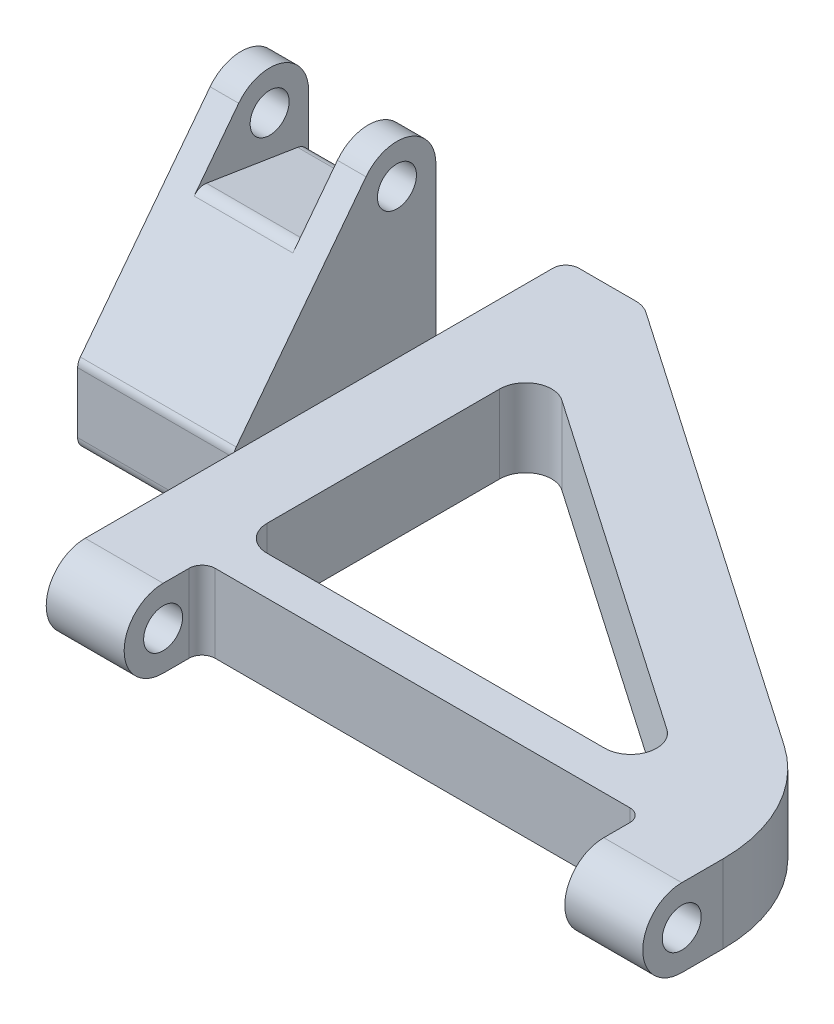
from build123d import *
from build123d.topology import SkipClean

# Parameters (mm, degrees)
BOSS_EXTRUDE1_DEPTH = 19.05
SKETCH7_R           = 4.7625
CUT_EXTRUDE7_DEPTH  = 38.1
FILLET4_R           = 38.1
FILLET5_R           = 6.35
SKETCH8_R           = 4.7625
CUT_EXTRUDE8_DEPTH  = 195.283940649
FILLET6_RADIUS      = 9.525
FILLET6_LENGTH      = 19.05
FILLET7_RADIUS      = 9.525
FILLET7_LENGTH      = 19.05
CUT_EXTRUDE9_START  = -19.05
CUT_EXTRUDE9_DEPTH  = 12.7
CUT_EXTRUDE10_START = -19.05
CUT_EXTRUDE10_DEPTH = 12.7
CUT_EXTRUDE11_START = -19.05
CUT_EXTRUDE11_DEPTH = 12.7
SKETCH12_R          = 4.7625
BOSS_EXTRUDE2_DEPTH = 38.1
CUT_EXTRUDE12_DEPTH = 34.925
CUT_EXTRUDE13_START = -6.985
SKETCH13_4_R        = 4.7625
CUT_EXTRUDE13_DEPTH = 24.13
FILLET13_R          = 3.175
FILLET14_R          = 3.175
FILLET15_R          = 3.175


with BuildPart() as part:
    # Sketch1 → Boss-Extrude1 (new body)
    with BuildSketch(Plane(origin=(0, 0, 0), x_dir=(1, 0, 0), z_dir=(0, 1, 0))):
        with BuildLine():
            ThreePointArc((3.175, 0), (0.92993597, -0.92993597), (0, -3.175))
            Line((0, -3.175), (0, -127))
            Line((0, -127), (19.05, -127))
            Line((19.05, -127), (19.05, -111.125))
            ThreePointArc((19.05, -111.125), (19.97993597, -108.87993597), (22.225, -107.95))
            Line((22.225, -107.95), (123.563707018, -107.95))
            ThreePointArc((123.563707018, -107.95), (125.808771048, -108.87993597), (126.738707018, -111.125))
            Line((126.738707018, -111.125), (126.738707018, -127))
            Line((126.738707018, -127), (145.788707018, -127))
            Line((145.788707018, -127), (145.788707018, -87.316702208))
            Line((145.788707018, -87.316702208), (19.05, 0))
            Line((19.05, 0), (3.175, 0))
        make_face()
        with BuildLine():
            Line((29.002606919, -29.990275978), (111.5275446, -86.845877379))
            ThreePointArc((111.5275446, -86.845877379), (113.98824654, -93.961474404), (107.924937681, -98.425))
            Line((107.924937681, -98.425), (25.4, -98.425))
            ThreePointArc((25.4, -98.425), (20.909871939, -96.565128061), (19.05, -92.075))
            Line((19.05, -92.075), (19.05, -35.2193986))
            ThreePointArc((19.05, -35.2193986), (22.446532033, -29.598052945), (29.002606919, -29.990275978))
        make_face(mode=Mode.SUBTRACT)
    extrude(amount=BOSS_EXTRUDE1_DEPTH)

    # Sketch7 → Cut-Extrude7 (cut)
    with BuildSketch(Plane(origin=(0, 0, 0), x_dir=(-1, 0, 0), z_dir=(0, 0, -1))):
        with Locations((-9.525, 9.525)):
            Circle(SKETCH7_R)
    extrude(amount=-CUT_EXTRUDE7_DEPTH, mode=Mode.SUBTRACT)

    # Fillet4
    fillet4_edges = [part.edges().sort_by_distance(p)[0] for p in [
        (145.788707018, 9.525, 87.316702208),
    ]]
    fillet(fillet4_edges, radius=FILLET4_R)

    # Fillet5
    fillet5_edges = [part.edges().sort_by_distance(p)[0] for p in [
        (19.05, 9.525, 0),
    ]]
    fillet(fillet5_edges, radius=FILLET5_R)

    # Sketch8 → Cut-Extrude8 (cut, through all)
    with BuildSketch(Plane.ZY):
        with Locations((117.475, 9.525)):
            Circle(SKETCH8_R)
    extrude(amount=-CUT_EXTRUDE8_DEPTH, mode=Mode.SUBTRACT)

    # Fillet6: full round fillet: the end face becomes a half cylinder, R = half its width
    fillet6_face = Plane((9.525, 9.525, 127), x_dir=(1, 0, 0), z_dir=(0, 0, 1))  # on the end face: x along it, z out of the body
    fillet6_slab = fillet6_face.offset(-FILLET6_RADIUS / 2) * Box(FILLET6_LENGTH, 2 * FILLET6_RADIUS, FILLET6_RADIUS, mode=Mode.PRIVATE)  # the body's end, R deep
    fillet6_round = Plane((9.525, 9.525, 117.475), x_dir=(0, 0, 1), z_dir=(1, 0, 0)) * Cylinder(FILLET6_RADIUS, FILLET6_LENGTH, mode=Mode.PRIVATE)  # its axis R under the face
    add(fillet6_slab - fillet6_round, mode=Mode.SUBTRACT)

    # Fillet7: full round fillet: the end face becomes a half cylinder, R = half its width
    fillet7_face = Plane((136.263707018, 9.525, 127), x_dir=(-1, 0, 0), z_dir=(0, 0, 1))  # on the end face: x along it, z out of the body
    fillet7_slab = fillet7_face.offset(-FILLET7_RADIUS / 2) * Box(FILLET7_LENGTH, 2 * FILLET7_RADIUS, FILLET7_RADIUS, mode=Mode.PRIVATE)  # the body's end, R deep
    fillet7_round = Plane((136.263707018, 9.525, 117.475), x_dir=(0, 0, 1), z_dir=(-1, 0, 0)) * Cylinder(FILLET7_RADIUS, FILLET7_LENGTH, mode=Mode.PRIVATE)  # its axis R under the face
    add(fillet7_slab - fillet7_round, mode=Mode.SUBTRACT)

    # Sketch9 → Cut-Extrude9 (cut)
    with BuildSketch(Plane(origin=(0, 19.05, 0), x_dir=(1, 0, 0), z_dir=(0, 1, 0)).offset(CUT_EXTRUDE9_START)):
        with BuildLine():
            Line((6.985, -44.45), (12.065, -44.45))
            ThreePointArc((12.065, -44.45), (14.31006403, -45.37993597), (15.24, -47.625))
            Line((15.24, -47.625), (15.24, -92.075))
            Line((15.24, -92.075), (15.24, -102.87))
            ThreePointArc((15.24, -102.87), (14.31006403, -105.11506403), (12.065, -106.045))
            Line((12.065, -106.045), (6.985, -106.045))
            ThreePointArc((6.985, -106.045), (4.73993597, -105.11506403), (3.81, -102.87))
            Line((3.81, -102.87), (3.81, -47.625))
            ThreePointArc((3.81, -47.625), (4.73993597, -45.37993597), (6.985, -44.45))
        make_face()
    extrude(amount=CUT_EXTRUDE9_DEPTH, mode=Mode.SUBTRACT)

    # Sketch10 → Cut-Extrude10 (cut)
    with BuildSketch(Plane(origin=(0, 19.05, 0), x_dir=(1, 0, 0), z_dir=(0, 1, 0)).offset(CUT_EXTRUDE10_START)):
        with BuildLine():
            Line((20.6375, -11.763381719), (20.6375, -17.932294237))
            ThreePointArc((20.6375, -17.932294237), (21.001827173, -19.409028221), (22.011196541, -20.546855548))
            Line((22.011196541, -20.546855548), (63.441606739, -49.090359539))
            ThreePointArc((63.441606739, -49.090359539), (65.81797034, -49.598286152), (67.857471509, -48.277101687))
            Line((67.857471509, -48.277101687), (70.739557043, -44.09380359))
            ThreePointArc((70.739557043, -44.09380359), (71.247483656, -41.717439989), (69.926299192, -39.67793882))
            Line((69.926299192, -39.67793882), (25.613803459, -9.148820408))
            ThreePointArc((25.613803459, -9.148820408), (22.335766016, -8.952708891), (20.6375, -11.763381719))
        make_face()
        with BuildLine():
            Line((123.418648971, -80.387093072), (120.536563436, -84.570391169))
            ThreePointArc((120.536563436, -84.570391169), (118.497062267, -85.891575634), (116.120698666, -85.383649021))
            Line((116.120698666, -85.383649021), (71.808202933, -54.854530608))
            ThreePointArc((71.808202933, -54.854530608), (70.487018469, -52.815029439), (70.994945082, -50.438665838))
            Line((70.994945082, -50.438665838), (73.877030616, -46.255367741))
            ThreePointArc((73.877030616, -46.255367741), (75.916531785, -44.934183277), (78.292895386, -45.44210989))
            Line((78.292895386, -45.44210989), (122.605391119, -75.971228302))
            ThreePointArc((122.605391119, -75.971228302), (123.926575583, -78.010729471), (123.418648971, -80.387093072))
        make_face()
    extrude(amount=CUT_EXTRUDE10_DEPTH, mode=Mode.SUBTRACT)

    # Sketch11 → Cut-Extrude11 (cut)
    with BuildSketch(Plane(origin=(0, 19.05, 0), x_dir=(1, 0, 0), z_dir=(0, 1, 0)).offset(CUT_EXTRUDE11_START)):
        with BuildLine():
            Line((117.723743339, -104.14), (138.043743339, -104.14))
            ThreePointArc((138.043743339, -104.14), (140.775902425, -102.582384223), (140.82733452, -99.437831007))
            Line((140.82733452, -99.437831007), (131.819281268, -83.018732847))
            ThreePointArc((131.819281268, -83.018732847), (129.196718657, -81.374987965), (126.421128775, -82.74459838))
            Line((126.421128775, -82.74459838), (115.109182028, -99.163696541))
            ThreePointArc((115.109182028, -99.163696541), (114.913070511, -102.441733984), (117.723743339, -104.14))
        make_face()
    extrude(amount=CUT_EXTRUDE11_DEPTH, mode=Mode.SUBTRACT)

    # Sketch12 → Boss-Extrude2 (add)
    with BuildSketch(Plane.ZY):
        with BuildLine():
            Line((31.761333992, 55.437605021), (31.761333992, 0))
            Line((31.761333992, 0), (81.213525096, 0))
            Line((81.213525096, 0), (81.213525096, 19.05))
            Line((81.213525096, 19.05), (48.843024558, 61.236057633))
            ThreePointArc((48.843024558, 61.236057633), (38.224623085, 64.457114505), (31.761333992, 55.437605021))
        make_face()
        with Locations(Location((41.286333992, 55.437605021, 0), (0, 0, 180))):
            Circle(SKETCH12_R, mode=Mode.SUBTRACT)
    extrude(amount=BOSS_EXTRUDE2_DEPTH)

    # Sketch13 → Cut-Extrude12 (cut)
    with BuildSketch(Plane.ZY.offset(38.1)):
        with BuildLine():
            Line((34.936333992, 39.772832304), (34.936333992, 18.134396169))
            ThreePointArc((34.936333992, 18.134396169), (37.154655789, 15.106956357), (40.709809152, 16.309964245))
            Line((40.709809152, 16.309964245), (57.81580954, 40.673447753))
            ThreePointArc((57.81580954, 40.673447753), (57.910209366, 44.179857475), (54.717843702, 45.633343608))
            Line((54.717843702, 45.633343608), (37.611843313, 42.908296235))
            ThreePointArc((37.611843313, 42.908296235), (35.696120968, 41.833747404), (34.936333992, 39.772832304))
        make_face()
        with BuildLine():
            Line((41.668763699, 3.175), (73.114694638, 3.175))
            ThreePointArc((73.114694638, 3.175), (75.78099304, 4.626202497), (76.009912608, 7.653202941))
            Line((76.009912608, 7.653202941), (64.11901518, 34.070224292))
            ThreePointArc((64.11901518, 34.070224292), (61.563303547, 35.923817266), (58.671896573, 34.656049709))
            Line((58.671896573, 34.656049709), (39.116863062, 8.239028358))
            ThreePointArc((39.116863062, 8.239028358), (38.833425091, 4.921196311), (41.668763699, 3.175))
        make_face()
    extrude(amount=-CUT_EXTRUDE12_DEPTH, mode=Mode.SUBTRACT)

    # Sketch13<4> → Cut-Extrude13 (cut)
    # profile 1 of 3: a face of its own
    with SkipClean():  # the faces are left unmerged after this step: merging them gives an invalid solid
        with BuildSketch(Plane.ZY.offset(38.1).offset(CUT_EXTRUDE13_START)):
            with BuildLine():
                Line((37.611843313, 42.908296235), (54.717843702, 45.633343608))
                ThreePointArc((54.717843702, 45.633343608), (57.910209366, 44.179857475), (57.81580954, 40.673447753))
                Line((57.81580954, 40.673447753), (40.709809152, 16.309964245))
                ThreePointArc((40.709809152, 16.309964245), (37.154655789, 15.106956357), (34.936333992, 18.134396169))
                Line((34.936333992, 18.134396169), (34.936333992, 39.772832304))
                ThreePointArc((34.936333992, 39.772832304), (35.696120968, 41.833747404), (37.611843313, 42.908296235))
            make_face()
        # profile 2 of 3: a face of its own
        with BuildSketch(Plane.ZY.offset(38.1).offset(CUT_EXTRUDE13_START)):
            with BuildLine():
                Line((31.761333992, 44.275117198), (58.579423638, 48.547335312))
                Line((58.579423638, 48.547335312), (48.843044303, 61.236059961))
                ThreePointArc((48.843044303, 61.236059961), (38.22461551, 64.457129972), (31.761316911, 55.437590446))
                Line((31.761316911, 55.437590446), (31.761333992, 44.275117198))
            make_face()
            with Locations(Location((41.286333992, 55.437605021, 0), (0, 0, 180))):
                Circle(SKETCH13_4_R, mode=Mode.SUBTRACT)
        # profile 3 of 3: a face of its own
        with BuildSketch(Plane.ZY.offset(38.1).offset(CUT_EXTRUDE13_START)):
            with BuildLine():
                Line((39.116863062, 8.239028358), (58.671896573, 34.656049709))
                ThreePointArc((58.671896573, 34.656049709), (61.563303547, 35.923817266), (64.11901518, 34.070224292))
                Line((64.11901518, 34.070224292), (76.009912608, 7.653202941))
                ThreePointArc((76.009912608, 7.653202941), (75.78099304, 4.626202497), (73.114694638, 3.175))
                Line((73.114694638, 3.175), (41.668763699, 3.175))
                ThreePointArc((41.668763699, 3.175), (38.833425091, 4.921196311), (39.116863062, 8.239028358))
            make_face()
        extrude(amount=-CUT_EXTRUDE13_DEPTH, mode=Mode.SUBTRACT)
    add(part.part.scale(1), mode=Mode.REPLACE)  # the faces are merged on a copy

    # Fillet13
    fillet13_edges = [part.edges().sort_by_distance(p)[0] for p in [
        (-19.05, 44.275117198, 31.761333992),
        (-19.05, 48.547335312, 58.579423638),
    ]]
    fillet(fillet13_edges, radius=FILLET13_R)

    # Fillet14
    fillet14_edges = [part.edges().sort_by_distance(p)[0] for p in [
        (-19.05, 0, 31.761333992),
    ]]
    fillet(fillet14_edges, radius=FILLET14_R)

    # Fillet15
    # the kernel refuses this fillet: 3.175 mm, written as the material it takes off along each edge
    with BuildSketch(Plane(origin=(0, 19.05, 81.213525096), x_dir=(0, 0.7933533402912315, -0.6087614290087253), z_dir=(-1, 0, 0))) as fillet15_piece_1:
        with BuildLine():
            CenterArc((FILLET15_R * 0.339454258863, FILLET15_R), FILLET15_R, 232.5, 37.5)
            Line((-FILLET15_R * 0.269307170145, FILLET15_R * 0.206646659709), (0, 0))
            Line((0, 0), (FILLET15_R * 0.339454258863, 0))
        make_face()
    extrude(amount=40.79441818, mode=Mode.SUBTRACT)
    with BuildSketch(Plane(origin=(0, 0, 81.213525096), x_dir=(0, 0, -1), z_dir=(-1, 0, 0))) as fillet15_piece_2:
        with BuildLine():
            CenterArc((FILLET15_R, -FILLET15_R), FILLET15_R, 90, 90)
            Line((0, -FILLET15_R), (0, 0))
            Line((0, 0), (FILLET15_R, 0))
        make_face()
    extrude(amount=46.0375, mode=Mode.SUBTRACT)


solid = part.part
